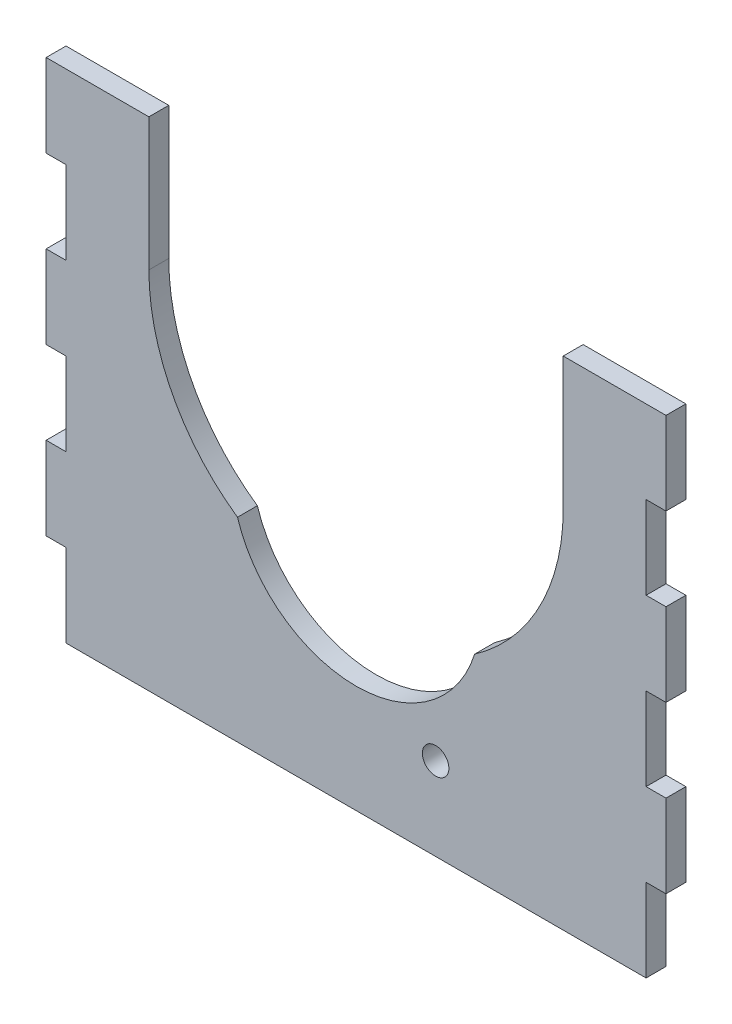
from build123d import *

# Parameters (mm, degrees)
BOSS_EXTRUDE1_DEPTH   = 6
SKETCH2_W             = 6
SKETCH2_H             = 25
BOSS_EXTRUDE2_DEPTH   = 6
LPATTERN1_START       = 25
LPATTERN1_OUTLINE_W   = 6
LPATTERN1_OUTLINE_H   = 6
LPATTERN1_DEPTH       = 25
LPATTERN1_START_2     = 75
LPATTERN1_2_OUTLINE_W = 6
LPATTERN1_2_OUTLINE_H = 6
LPATTERN1_2_DEPTH     = 25
LPATTERN1_START_3     = 125
LPATTERN1_3_OUTLINE_W = 6
LPATTERN1_3_OUTLINE_H = 6
LPATTERN1_3_DEPTH     = 25
SKETCH5_R             = 4
CUT_EXTRUDE1_DEPTH    = 236.153141591


# Read off the part's stored shape, not the designer's step: LPattern1
with BuildPart() as part:
    # Sketch1 → Boss-Extrude1 (new body)
    with BuildSketch(Plane.XY):
        with BuildLine():
            Line((-150, 150), (-175, 150))
            Line((-175, 150), (-175, 0))
            Line((-175, 0), (0, 0))
            Line((0, 0), (0, 150))
            Line((0, 150), (-25, 150))
            Line((-25, 150), (-25, 110))
            ThreePointArc((-25, 110), (-32.083192968, 81.099697262), (-51.727279947, 58.75))
            ThreePointArc((-51.727279947, 58.75), (-87.5, 32.5), (-123.272720053, 58.75))
            ThreePointArc((-123.272720053, 58.75), (-142.916807032, 81.099697262), (-150, 110))
            Line((-150, 110), (-150, 150))
        make_face()
    extrude(amount=BOSS_EXTRUDE1_DEPTH)

    # Sketch2 → Boss-Extrude2 (add)
    with BuildSketch(Plane.XY.offset(6)):
        with Locations((-178, 137.5)):
            Rectangle(SKETCH2_W, SKETCH2_H)
    extrude(amount=-BOSS_EXTRUDE2_DEPTH)

    # LPattern1 outline → LPattern1 (add)
    with BuildSketch(Plane(origin=(0, 0, 0), x_dir=(1, 0, 0), z_dir=(0, 1, 0)).offset(LPATTERN1_START)):
        with Locations((-178, -3)):
            Rectangle(LPATTERN1_OUTLINE_W, LPATTERN1_OUTLINE_H)
        with Locations((3, -3)):
            Rectangle(LPATTERN1_OUTLINE_W, LPATTERN1_OUTLINE_H)
    extrude(amount=LPATTERN1_DEPTH)

    # LPattern1 2 outline → LPattern1 2 (add)
    with BuildSketch(Plane(origin=(0, 0, 0), x_dir=(1, 0, 0), z_dir=(0, 1, 0)).offset(LPATTERN1_START_2)):
        with Locations((-178, -3)):
            Rectangle(LPATTERN1_2_OUTLINE_W, LPATTERN1_2_OUTLINE_H)
        with Locations((3, -3)):
            Rectangle(LPATTERN1_2_OUTLINE_W, LPATTERN1_2_OUTLINE_H)
    extrude(amount=LPATTERN1_2_DEPTH)

    # LPattern1 3 outline → LPattern1 3 (add)
    with BuildSketch(Plane(origin=(0, 0, 0), x_dir=(1, 0, 0), z_dir=(0, 1, 0)).offset(LPATTERN1_START_3)):
        with Locations((3, -3)):
            Rectangle(LPATTERN1_3_OUTLINE_W, LPATTERN1_3_OUTLINE_H)
    extrude(amount=LPATTERN1_3_DEPTH)

    # Sketch5 → Cut-Extrude1 (cut, through all)
    with BuildSketch(Plane.XY.offset(6)):
        with Locations((-63.5, 25)):
            Circle(SKETCH5_R)
    extrude(amount=-CUT_EXTRUDE1_DEPTH, mode=Mode.SUBTRACT)


solid = part.part
